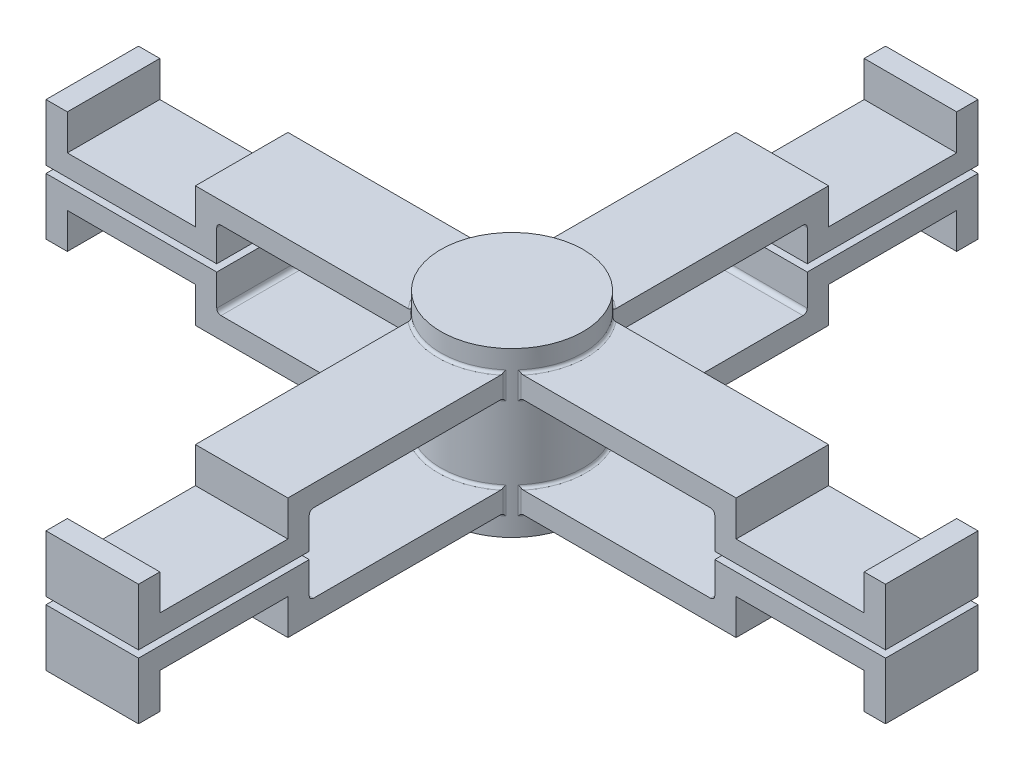
from build123d import *

# Parameters (mm, degrees)
SKETCH2_W                = 5
SKETCH2_H                = 5.75
SINGLE_LEG_EXTRUDE_DEPTH = 3.25
LEG_PATTERN_COUNT        = 4
CONNECTION_1_REACH       = 47.755
SKETCH4_W                = 6.5
SKETCH4_H                = 1.5
CONNECTION_2_OUTLINE_W   = 6.5
CONNECTION_2_OUTLINE_H   = 1.5
CONNECTION_2_DEPTH       = 1.200328962
SKETCH13_W               = 6.5
SKETCH13_H               = 1.5
CONNECTION_4_DEPTH       = 1.200329
SKETCH14_W               = 6.5
SKETCH14_H               = 1.5
CONNECTION3_DEPTH        = 1.200329
FILLET1_R                = 0.2
FILLET2_R                = 0.3


# Read off the part's stored shape, not the designer's step: Connection 2
with BuildPart() as part:
    # Sketch2 → Shaft Top (revolve)
    with BuildSketch(Plane.XY, mode=Mode.PRIVATE) as shaft_top_sk:
        with Locations((2.5, 2.875)):
            Rectangle(SKETCH2_W, SKETCH2_H)
    revolve(shaft_top_sk.sketch.rotate(Axis((0, 0, 0), (0, 1, 0)), 90), axis=Axis((0, 0, 0), (0, 1, 0)))

    # Sketch4 → Connection 1 (add, up to next)
    with BuildSketch(Plane.ZY.offset(-5), mode=Mode.PRIVATE) as connection_1_sk1:
        with Locations((0, 3.5)):
            Rectangle(SKETCH4_W, SKETCH4_H)
    connection_1_tool1 = extrude(connection_1_sk1.sketch, amount=CONNECTION_1_REACH, mode=Mode.PRIVATE) - part.part


with BuildPart() as body_2:
    # Sketch3 → Single Leg Extrude (new, symmetric)
    with BuildSketch(Plane.XY):
        Polygon((5, 4.25), (19, 4.25), (19, 1.75), (28, 1.75), (28, 4.25), (29.5, 4.25), (29.5, 0.25), (17.5, 0.25), (17.5, 2.75), (5, 2.75), align=None)
    extrude(amount=SINGLE_LEG_EXTRUDE_DEPTH, both=True)


with BuildPart() as leg_pattern_1:
    # Leg Pattern: pattern copy
    add(body_2.part.rotate(Axis((0, 0, 0), (0, 1, 0)), 1 * 360 / LEG_PATTERN_COUNT))


with BuildPart() as leg_pattern_2:
    # Leg Pattern: pattern copy
    add(body_2.part.rotate(Axis((0, 0, 0), (0, 1, 0)), 2 * 360 / LEG_PATTERN_COUNT))


with BuildPart() as leg_pattern_3:
    # Leg Pattern: pattern copy
    add(body_2.part.rotate(Axis((0, 0, 0), (0, 1, 0)), 3 * 360 / LEG_PATTERN_COUNT))


with BuildPart() as part_1:
    add(part.part)

    add(body_2.part)  # Connection 1 merges body 2
    add(connection_1_tool1.solids().sort_by_distance((5, 3.5, 0))[0])
    add(connection_1_tool1.solids().sort_by_distance((5, 3.5, 0))[1])


    add(leg_pattern_1.part)  # Connection 2 merges Leg Pattern_1
    # Connection 2 outline → Connection 2 (add)
    with BuildSketch(Plane.XY.offset(-5)):
        with Locations((0, 3.5)):
            Rectangle(CONNECTION_2_OUTLINE_W, CONNECTION_2_OUTLINE_H)
    extrude(amount=CONNECTION_2_DEPTH)


    add(leg_pattern_2.part)  # Connection 4 merges Leg Pattern_2
    # Sketch13 → Connection 4 (add)
    with BuildSketch(Plane(origin=(-5, 0, 0), x_dir=(0, 0, -1), z_dir=(1, 0, 0))):
        with Locations((0, 3.5)):
            Rectangle(SKETCH13_W, SKETCH13_H)
    extrude(amount=CONNECTION_4_DEPTH)


    add(leg_pattern_3.part)  # Connection3 merges Leg Pattern_3
    # Sketch14 → Connection3 (add)
    with BuildSketch(Plane(origin=(0, 0, 5), x_dir=(-1, 0, 0), z_dir=(0, 0, -1))):
        with Locations((0, 3.5)):
            Rectangle(SKETCH14_W, SKETCH14_H)
    extrude(amount=CONNECTION3_DEPTH)

    # Fillet1
    fillet1_edges = [part_1.edges().sort_by_distance(p)[0] for p in [
        (0, 2.75, 5),
        (-3.25, 3.5, 3.799671),
        (0, 4.25, 5),
        (-5, 2.75, 0),
        (-5, 4.25, 0),
        (-3.799671, 3.5, -3.25),
        (-3.799671, 3.5, 3.25),
        (3.799671038, 3.5, -3.25),
        (5, 2.75, 0),
        (5, 4.25, 0),
        (3.799671038, 3.5, 3.25),
        (3.25, 3.5, -3.799671038),
        (1.732288199, 2.75, -4.69032809),
        (1.732288199, 4.25, -4.69032809),
        (-3.25, 3.5, -3.799671038),
        (3.25, 3.5, 3.799671),
    ]]
    fillet(fillet1_edges, radius=FILLET1_R)

    # Fillet2
    fillet2_edges = [part_1.edges().sort_by_distance(p)[0] for p in [
        (0, 2.75, 17.5),
        (-17.5, 2.75, 0),
        (17.5, 2.75, 0),
        (0, 2.75, -17.5),
    ]]
    fillet(fillet2_edges, radius=FILLET2_R)

    # Mirror Bottom: part across plane


with BuildPart() as part_2:
    add(part_1.part)
    add(part_1.part.mirror(Plane(origin=(0, 0, 0), x_dir=(0, 0, 1), z_dir=(0, -1, 0))))


solid = part_2.part
